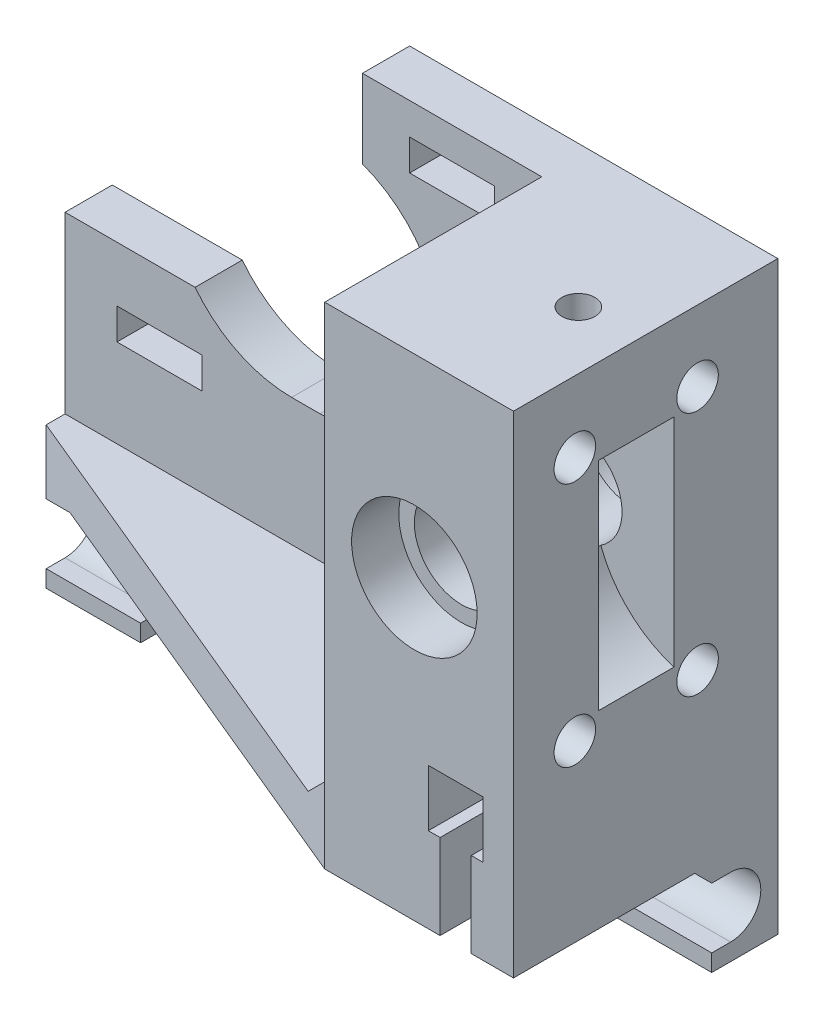
from build123d import *

# Parameters (mm, degrees)
SKETCH1_R               = 5
SKETCH1_W               = 9
SKETCH1_H               = 3.3
BOSS_EXTRUDE1_DEPTH     = 28
SKETCH2_W               = 50.5
SKETCH2_H               = 47
CUT_EXTRUDE1_DEPTH      = 23
SKETCH3_R               = 6.65
CUT_EXTRUDE2_DEPTH      = 5
CUT_EXTRUDE3_START      = -5
SKETCH4_R               = 6.65
CUT_EXTRUDE3_DEPTH      = 5
SKETCH5_R               = 12
CUT_EXTRUDE4_DEPTH      = 8
CUT_EXTRUDE5_START      = -9
CUT_EXTRUDE5_DEPTH      = 9
CUT_EXTRUDE6_DEPTH      = 6
SKETCH8_R               = 1.15
CUT_EXTRUDE7_DEPTH      = 85.190260719
CHAMFER1_SIZE           = 21
CHAMFER1_SIZE2          = 50.5
SKETCH9_R               = 2.2
CUT_EXTRUDE8_DEPTH      = 83.137080542
CUT_EXTRUDE9_DEPTH      = 3
CUT_EXTRUDE9_DEPTH_BACK = 7
BOSS_EXTRUDE2_DEPTH     = 10
LPATTERN1_COUNT         = 2
LPATTERN1_PITCH         = 60.5
SKETCH12_R              = 1.75
CUT_EXTRUDE10_DEPTH     = 10
CHAMFER2_SIZE           = 3
CHAMFER3_SIZE           = 1.8


with BuildPart() as part:
    # Sketch1 → Boss-Extrude1 (new body)
    with BuildSketch(Plane.XY):
        with BuildLine():
            Line((-60, -31.5), (10.5, -31.5))
            Line((10.5, -31.5), (10.5, 20.5))
            Line((10.5, 20.5), (-28.5, 20.5))
            Line((-28.5, 20.5), (-28.5, 12.180409823))
            ThreePointArc((-28.5, 12.180409823), (-20.217668105, -2.285689125), (-33, -12.985083113))
            Line((-33, -12.985083113), (-36, -12.985083113))
            ThreePointArc((-36, -12.985083113), (-41.689100041, -11.672468641), (-46.228019527, -8))
            Line((-46.228019527, -8), (-60, -8))
            Line((-60, -8), (-60, -31.5))
        make_face()
        Circle(SKETCH1_R, mode=Mode.SUBTRACT)
        with Locations((-19, 15.5)):
            Rectangle(SKETCH1_W, SKETCH1_H, mode=Mode.SUBTRACT)
        with Locations((-19, -15.5)):
            Rectangle(SKETCH1_W, SKETCH1_H, mode=Mode.SUBTRACT)
        with Locations((-50, -15.5)):
            Rectangle(SKETCH1_W, SKETCH1_H, mode=Mode.SUBTRACT)
    extrude(amount=BOSS_EXTRUDE1_DEPTH)

    # Sketch2 → Cut-Extrude1 (cut)
    with BuildSketch(Plane.XY.offset(28)):
        with Locations((-34.75, -3)):
            Rectangle(SKETCH2_W, SKETCH2_H)
    extrude(amount=-CUT_EXTRUDE1_DEPTH, mode=Mode.SUBTRACT)

    # Sketch3 → Cut-Extrude2 (cut)
    with BuildSketch(Plane.XY.offset(28)):
        Circle(SKETCH3_R)
    extrude(amount=-CUT_EXTRUDE2_DEPTH, mode=Mode.SUBTRACT)

    # Sketch4 → Cut-Extrude3 (cut)
    with BuildSketch(Plane(origin=(0, 0, 0), x_dir=(-1, 0, 0), z_dir=(0, 0, -1)).offset(CUT_EXTRUDE3_START)):
        with Locations(Location((0, 0, 0), (0, 0, 180))):
            Circle(SKETCH4_R)
    extrude(amount=CUT_EXTRUDE3_DEPTH, mode=Mode.SUBTRACT)

    # Sketch5 → Cut-Extrude4 (cut)
    with BuildSketch(Plane.XY.offset(11)):
        with Locations((14, 0)):
            Circle(SKETCH5_R)
    extrude(amount=CUT_EXTRUDE4_DEPTH, mode=Mode.SUBTRACT)

    # Sketch6 → Cut-Extrude5 (cut)
    with BuildSketch(Plane.XZ.offset(31.5).offset(CUT_EXTRUDE5_START)):
        with BuildLine():
            Line((2.725, 15), (2.725, 28))
            Line((2.725, 28), (6.025, 28))
            Line((6.025, 28), (6.025, 15))
            ThreePointArc((6.025, 15), (4.375, 13.35), (2.725, 15))
        make_face()
    extrude(amount=CUT_EXTRUDE5_DEPTH, mode=Mode.SUBTRACT)

    # Sketch7 → Cut-Extrude6 (cut)
    with BuildSketch(Plane.XZ.offset(22.5)):
        Polygon((1.475, 28), (7.275, 28), (7.275, 13.325684219), (4.375, 11.651368439), (1.475, 13.325684219), align=None)
    extrude(amount=-CUT_EXTRUDE6_DEPTH, mode=Mode.SUBTRACT)

    # Sketch8 → Cut-Extrude7 (cut, through all)
    with BuildSketch(Plane.XZ.offset(31.5)):
        with Locations(Location((4.375, 15, 0), (0, 0, 270))):
            Circle(SKETCH8_R)
    extrude(amount=-CUT_EXTRUDE7_DEPTH, mode=Mode.SUBTRACT)

    # Chamfer1
    chamfer1_edges = [part.edges().sort_by_distance(p)[0] for p in [
        (-60, -29, 28),
    ]]
    chamfer1_side = [part.faces().sort_by_distance(p)[0] for p in [
        (-60, -19.75, 0.365547535),
    ]]
    chamfer(chamfer1_edges, length=CHAMFER1_SIZE, length2=CHAMFER1_SIZE2, reference=chamfer1_side[0])

    # Sketch9 → Cut-Extrude8 (cut, through all)
    with BuildSketch(Plane(origin=(10.5, 0, 0), x_dir=(0, 0, -1), z_dir=(1, 0, 0))):
        with Locations((-8.5, 13)):
            Circle(SKETCH9_R)
        with Locations(Location((-21.5, 13, 0), (0, 0, 90))):
            Circle(SKETCH9_R)
        with Locations(Location((-8.5, -13, 0), (0, 0, 90))):
            Circle(SKETCH9_R)
        with Locations((-21.5, -13)):
            Circle(SKETCH9_R)
    extrude(amount=-CUT_EXTRUDE8_DEPTH, mode=Mode.SUBTRACT)

    # Sketch10 → Cut-Extrude9 (cut, two sides: drawn at the far end of the back side and taken through both)
    with BuildSketch(Plane.ZY.offset(9.5).offset(-CUT_EXTRUDE9_DEPTH_BACK)):
        Polygon((4.85, 15.107328483), (4.85, 10.892671517), (8.5, 8.785343035), (12.15, 10.892671517), (12.15, 15.107328483), (8.5, 17.214656965), align=None)
        Polygon((25.15, 10.892671517), (25.15, 15.107328483), (21.5, 17.214656965), (17.85, 15.107328483), (17.85, 10.892671517), (21.5, 8.785343035), align=None)
        Polygon((25.15, -10.892671517), (21.5, -8.785343035), (17.85, -10.892671517), (17.85, -15.107328483), (21.5, -17.214656965), (25.15, -15.107328483), align=None)
        Polygon((12.15, -10.892671517), (8.5, -8.785343035), (4.85, -10.892671517), (4.85, -15.107328483), (8.5, -17.214656965), (12.15, -15.107328483), align=None)
    extrude(amount=CUT_EXTRUDE9_DEPTH + CUT_EXTRUDE9_DEPTH_BACK, mode=Mode.SUBTRACT)

    # Sketch11 → Boss-Extrude2 (add)
    with BuildSketch(Plane(origin=(10.5, 0, 0), x_dir=(0, 0, -1), z_dir=(1, 0, 0))):
        with BuildLine():
            Line((0, -31.5), (-7, -31.5))
            Line((-7, -31.5), (-7, -33.3))
            Line((-7, -33.3), (-5, -33.3))
            ThreePointArc((-5, -33.3), (-1.8, -36.5), (-5, -39.7))
            Line((-5, -39.7), (-7, -39.7))
            Line((-7, -39.7), (-7, -41.5))
            Line((-7, -41.5), (0, -41.5))
            Line((0, -41.5), (0, -31.5))
        make_face()
    boss_extrude2 = extrude(amount=-BOSS_EXTRUDE2_DEPTH)

    # LPattern1: Boss-Extrude2 ×2
    with Locations(*[(-i * LPATTERN1_PITCH, 0, 0) for i in range(1, LPATTERN1_COUNT)]):
        add(boss_extrude2)

    # Sketch12 → Cut-Extrude10 (cut)
    with BuildSketch(Plane(origin=(0, 20.5, 0), x_dir=(1, 0, 0), z_dir=(0, 1, 0))):
        with Locations(Location((4.375, -15, 0), (0, 0, 270))):
            Circle(SKETCH12_R)
    extrude(amount=-CUT_EXTRUDE10_DEPTH, mode=Mode.SUBTRACT)

    # Chamfer2
    chamfer2_edges = [part.edges().sort_by_distance(p)[0] for p in [
        (-9.5, -26.5, 16.5),
    ]]
    chamfer(chamfer2_edges, length=CHAMFER2_SIZE)

    # Chamfer3
    chamfer3_edges = [part.edges().sort_by_distance(p)[0] for p in [
        (-55, -31.5, 7),
        (5.5, -31.5, 7),
    ]]
    chamfer(chamfer3_edges, length=CHAMFER3_SIZE - 0.0001)  # a hair under: the kernel refuses the full size


solid = part.part
